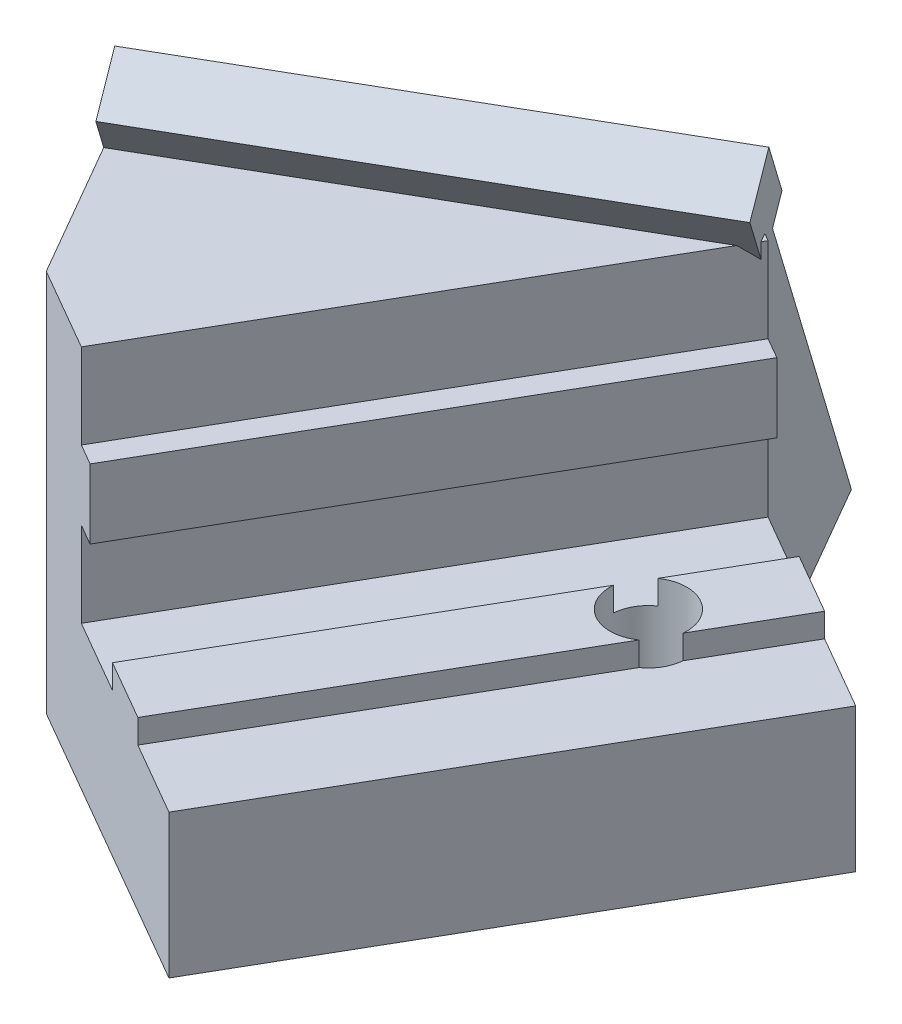
from build123d import *

# Parameters (mm, degrees)
BOSS_EXTRU_1_DEPTH             = 20
ESQUISSE2_R                    = 1.6
HOLEFORLAUNCHERFIXING_DEPTH    = 26.298221281
ESQUISSE4_W                    = 22.287049145
ESQUISSE4_H                    = 34.815979295
ENL_V_MAT_EXTRU_3_DEPTH        = 6
MAKERBEANFIXING_DEPTH          = 21
ESQUISSE6_W                    = 20
ESQUISSE6_H                    = 3
ANTIROTATIONSYSTEM_DEPTH       = 1.25
ESQUISSE7_R                    = 1.6
TOPMAKERBEANFIXINGHOLE_DEPTH   = 29.924856532
ENL_V_MAT_EXTRU_4_DEPTH        = 33.419265786
ESQUISSE3_R                    = 4.25
BIGHOLEFORLAUNCHERFIXING_DEPTH = 32.955759287
ENL_V_MAT_EXTRU_5_DEPTH        = 46.782998845
ENL_V_MAT_EXTRU_5_DEPTH_BACK   = 46.782998845
ESQUISSE9_W                    = 28.92820323
ESQUISSE9_H                    = 18.811533479


with BuildPart() as part:
    # Esquisse1 → Boss.-Extru.1 (new body)
    with BuildSketch(Plane.XY):
        Polygon((8, 16), (17.237604307, 0), (0, 0), (0, 16), align=None)
    extrude(amount=BOSS_EXTRU_1_DEPTH)

    # Esquisse2 → HoleForLauncherFixing (cut, through all)
    with BuildSketch(Plane(origin=(12.92820323, 7.464101615, 0), x_dir=(0, 0, -1), z_dir=(0.8660254037844397, 0.49999999999999806, 0))):
        with Locations((-10, -0.618802154)):
            Circle(ESQUISSE2_R)
    extrude(amount=-HOLEFORLAUNCHERFIXING_DEPTH, mode=Mode.SUBTRACT)

    # Esquisse4 → Enlèv. mat.-Extru.3 (cut)
    with BuildSketch(Plane(origin=(0, 0, 0), x_dir=(0, -1, 0), z_dir=(-0.8660254037844398, 0, -0.499999999999998))):
        with Locations((-6.644134867, 0.407683814)):
            Rectangle(ESQUISSE4_W, ESQUISSE4_H)
    extrude(amount=-ENL_V_MAT_EXTRU_3_DEPTH, mode=Mode.SUBTRACT)

    # Esquisse5 → MakerBeanFixing (add)
    with BuildSketch(Plane(origin=(-3.464101615, 0, 18), x_dir=(-0.8660254037844398, 0, -0.49999999999999806), z_dir=(0.499999999999998, 0, -0.8660254037844397))):
        Polygon((-4, 0), (10, 0), (10, 6), (6.45, 6), (6.45, 7), (3.55, 7), (3.55, 6), (0, 6), (0, 9.55), (1, 9.55), (1, 12.45), (0, 12.45), (0, 16), (-4, 16), align=None)
    extrude(amount=MAKERBEANFIXING_DEPTH)

    # Esquisse6 → AntiRotationSystem (add, symmetric)
    with BuildSketch(Plane(origin=(12.92820323, 7.464101615, 0), x_dir=(0, 0, -1), z_dir=(0.8660254037844398, 0.4999999999999981, 0))):
        with Locations((-10, 10.881197846)):
            Rectangle(ESQUISSE6_W, ESQUISSE6_H)
    extrude(amount=ANTIROTATIONSYSTEM_DEPTH, both=True)

    # Esquisse7 → TopMakerBeanFixingHole (cut, through all)
    with BuildSketch(Plane(origin=(0, 7, 0), x_dir=(1, 0, 0), z_dir=(0, 1, 0))):
        with Locations((0.205771366, -1.643593539)):
            Circle(ESQUISSE7_R)
    extrude(amount=-TOPMAKERBEANFIXINGHOLE_DEPTH, mode=Mode.SUBTRACT)

    # Esquisse8 → Enlèv. mat.-Extru.4 (cut, through all)
    with BuildSketch(Plane(origin=(0, 0, 0), x_dir=(-1, 0, 0), z_dir=(0, 0, -1))):
        Polygon((-8.237604307, 15.588457268), (-17.237604307, 0), (-20.918212273, 2.125), (-10.418212273, 20.311533479), (-7.820136062, 18.811533479), (-9.320136062, 16.213457268), align=None)
    extrude(amount=-ENL_V_MAT_EXTRU_4_DEPTH, mode=Mode.SUBTRACT)

    # Esquisse3 → BigHoleForLauncherFixing (cut, through all)
    with BuildSketch(Plane(origin=(8.598076211, 4.964101615, 0), x_dir=(0, 0, -1), z_dir=(0.8660254037844397, 0.49999999999999806, 0))):
        with Locations((-10, -0.618802154)):
            Circle(ESQUISSE3_R)
    extrude(amount=-BIGHOLEFORLAUNCHERFIXING_DEPTH, mode=Mode.SUBTRACT)


with BuildPart() as body_2:
    # Symétrie1: mirrored copy
    add(part.part.mirror(Plane(origin=(-1.624355653, 0, -5.186533479), x_dir=(-0.49999999999999806, 0, 0.8660254037844398), z_dir=(0.8660254037844398, 0, 0.49999999999999806))))


with BuildPart() as part_1:
    add(part.part)

    # Esquisse9 → Enlèv. mat.-Extru.5 (cut, two sides: drawn at the far end of the back side and taken through both)
    with BuildSketch(Plane(origin=(1.839745962, 0, -3.186533479), x_dir=(-0.8660254037844397, 0, -0.49999999999999806), z_dir=(0.49999999999999806, 0, -0.8660254037844397)).offset(-ENL_V_MAT_EXTRU_5_DEPTH_BACK)):
        with Locations((-10.464101615, 9.40576674)):
            Rectangle(ESQUISSE9_W, ESQUISSE9_H)
    extrude(amount=ENL_V_MAT_EXTRU_5_DEPTH + ENL_V_MAT_EXTRU_5_DEPTH_BACK, mode=Mode.SUBTRACT)


solid = body_2.part
